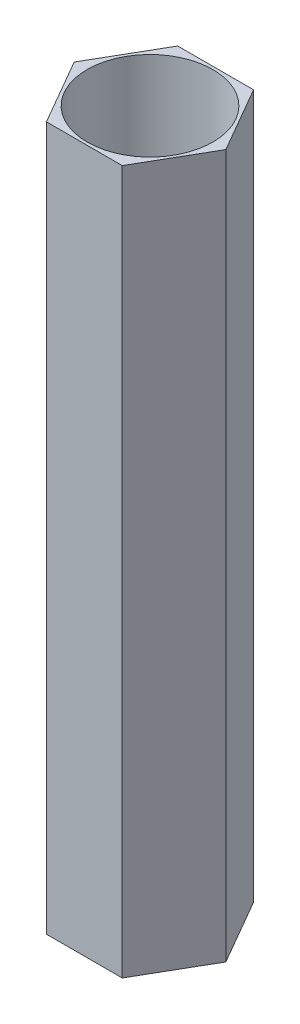
from build123d import *

# Parameters (mm, degrees)
SKETCH1_R           = 2.25
BOSS_EXTRUDE1_DEPTH = 25.18


with BuildPart() as part:
    # Sketch1 → Boss-Extrude1 (new body)
    with BuildSketch(Plane(origin=(0, 0, 0), x_dir=(1, 0, 0), z_dir=(0, 1, 0))):
        Polygon((1.356773133, -2.35), (2.713546265, 0), (1.356773133, 2.35), (-1.356773133, 2.35), (-2.713546265, 0), (-1.356773133, -2.35), align=None)
        Circle(SKETCH1_R, mode=Mode.SUBTRACT)
    extrude(amount=BOSS_EXTRUDE1_DEPTH)


solid = part.part
